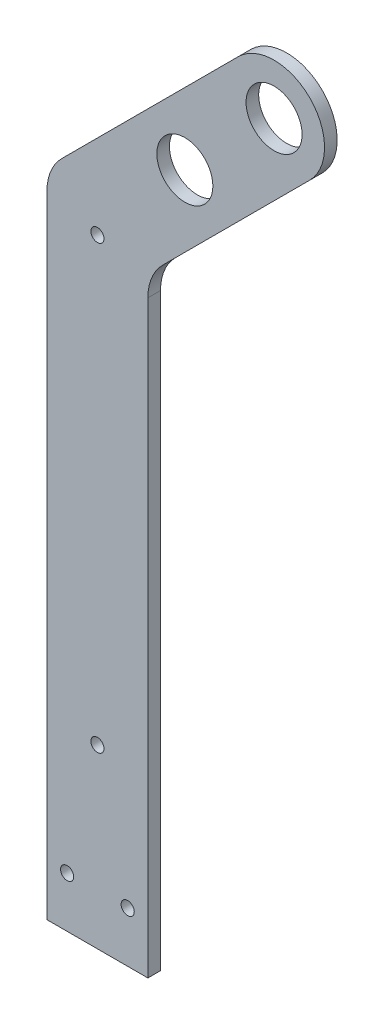
from build123d import *

# Parameters (mm, degrees)
SKETCH_1_R                = 20
SKETCH_1_R_2              = 11.1
EXTRUDE_1_DEPTH           = 60
EXTRUDE_2_DEPTH           = 30
SKETCH_4_R                = 11
EXTRUDE_3_DEPTH           = 5
SKETCH_8_R                = 11.1
CUT_EXTRUDE_1_DEPTH       = 100
FILLET_4_R                = 20
EXTRUDE_START             = -30
SKETCH_18_R               = 35
EXTRUDE_4_DEPTH           = 5
EXTRUDE_START_2           = -25
SKETCH_19_R               = 35
EXTRUDE_5_DEPTH           = 5
FILLET_5_R                = 10
CUT_EXTRUDE_9_DEPTH       = 388.169213652
CUT_EXTRUDE_9_DEPTH_BACK  = 388.169213652
SKETCH_21_R               = 2.6
CUT_EXTRUDE_10_DEPTH      = 407.881000043
CUT_EXTRUDE_10_DEPTH_BACK = 407.881000043
SKETCH_22_W               = 25
SKETCH_22_H               = 454.716430135
SKETCH_22_W_2             = 40
SKETCH_22_H_2             = 431.087956996


with BuildPart() as part:
    # 草图1 → 凸台-拉伸1 (new body)
    with BuildSketch(Plane.XY):
        Circle(SKETCH_1_R)
        Circle(SKETCH_1_R_2, mode=Mode.SUBTRACT)
    extrude(amount=EXTRUDE_1_DEPTH)

    # 草图2 → 凸台-拉伸2 (add, symmetric)
    with BuildSketch(Plane.XY.offset(30)):
        with BuildLine():
            Line((-14.142135624, 14.142135624), (-90, -61.715728753))
            Line((-90, -61.715728753), (-90, -320))
            Line((-90, -320), (-50, -320))
            Line((-50, -320), (-50, -78.284271247))
            Line((-50, -78.284271247), (14.142135624, -14.142135624))
            ThreePointArc((14.142135624, -14.142135624), (-14.142135624, -14.142135624), (-14.142135624, 14.142135624))
        make_face()
    extrude(amount=EXTRUDE_2_DEPTH, both=True)

    # 草图4 → 凸台-拉伸3 (add)
    with BuildSketch(Plane.XY.offset(60)):
        with BuildLine():
            Line((-90, -290), (-50, -290))
            Line((-50, -290), (-50, -350))
            ThreePointArc((-50, -350), (-70, -370), (-90, -350))
            Line((-90, -350), (-90, -290))
        make_face()
        with Locations((-70, -350)):
            Circle(SKETCH_4_R, mode=Mode.SUBTRACT)
    extrude_3 = extrude(amount=EXTRUDE_3_DEPTH)

    # 镜向1: 凸台-拉伸3 across plane
    add(extrude_3.mirror(Plane.XY.offset(30)))

    # 草图8 → 切除-拉伸1 (cut)
    with BuildSketch(Plane.XY.offset(60)):
        with Locations((-35.355339059, -35.355339059)):
            Circle(SKETCH_8_R)
    extrude(amount=-CUT_EXTRUDE_1_DEPTH, mode=Mode.SUBTRACT)

    # 圆角4
    fillet_4_edges = [part.edges().sort_by_distance(p)[0] for p in [
        (-50, -78.284271247, 30),
        (-90, -61.715728753, 30),
    ]]
    fillet(fillet_4_edges, radius=FILLET_4_R)

    # 草图18 → 凸台-拉伸4 (add)
    with BuildSketch(Plane.XY.offset(60).offset(EXTRUDE_START)):
        with BuildLine():
            ThreePointArc((15.487252676, -12.654841151), (14.833346688, -13.415357842), (14.142135624, -14.142135624))
            Line((14.142135624, -14.142135624), (-44.142135624, -72.426406871))
            ThreePointArc((-44.142135624, -72.426406871), (-48.47759065, -78.914873848), (-50, -86.568542495))
            Line((-50, -86.568542495), (-50, -128.513280962))
            Line((-50, -128.513280962), (20.291868618, -128.513280962))
            ThreePointArc((20.291868618, -128.513280962), (62.790327113, -100.116718851), (52.818780552, -49.986369028))
            Line((52.818780552, -49.986369028), (15.487252676, -12.654841151))
        make_face()
        with Locations((20.291868618, -82.513280962)):
            Circle(SKETCH_18_R, mode=Mode.SUBTRACT)
    extrude(amount=EXTRUDE_4_DEPTH)

    # 草图19 → 凸台-拉伸5 (add)
    with BuildSketch(Plane(origin=(0, 0, 0), x_dir=(-1, 0, 0), z_dir=(0, 0, -1)).offset(EXTRUDE_START_2)):
        with BuildLine():
            Line((50, -134.571348531), (50, -226.571348531))
            Line((50, -226.571348531), (-0.680255104, -226.571348531))
            ThreePointArc((-0.680255104, -226.571348531), (-46.680255104, -180.571348531), (-0.680255104, -134.571348531))
            Line((-0.680255104, -134.571348531), (50, -134.571348531))
        make_face()
        with Locations((-0.680255104, -180.571348531)):
            Circle(SKETCH_19_R, mode=Mode.SUBTRACT)
    extrude(amount=-EXTRUDE_5_DEPTH)

    # 圆角5
    # the kernel refuses this fillet: 10 mm, written as the material it adds along each edge
    with BuildSketch(Plane(origin=(-50, -226.571348531, 25), x_dir=(0, -1, 0), z_dir=(0, 0, 1)), Plane(origin=(-50, -128.513280962, 30), x_dir=(0, -1, 0), z_dir=(0, 0, 1))) as fillet_5_piece_1:
        with BuildLine():
            CenterArc((FILLET_5_R, FILLET_5_R), FILLET_5_R, 180, 90)
            Line((0, FILLET_5_R), (0, 0))
            Line((0, 0), (FILLET_5_R, 0))
        make_face()
    extrude(amount=5)

    # 草图21 → 切除-拉伸9 (cut, two sides: drawn at the far end of the back side and taken through both)
    with BuildSketch(Plane.XY.offset(65).offset(-CUT_EXTRUDE_9_DEPTH_BACK)):
        with Locations((-70, -75)):
            Circle(SKETCH_21_R)
        with Locations((-70, -250)):
            Circle(SKETCH_21_R)
        with Locations((-58, -300)):
            Circle(SKETCH_21_R)
        with Locations((-82, -300)):
            Circle(SKETCH_21_R)
    extrude(amount=CUT_EXTRUDE_9_DEPTH + CUT_EXTRUDE_9_DEPTH_BACK, mode=Mode.SUBTRACT)

    # 草图22 → 切除-拉伸10 (cut, two sides: drawn at the far end of the back side and taken through both)
    with BuildSketch(Plane.ZY.offset(90).offset(-CUT_EXTRUDE_10_DEPTH_BACK)):
        with Locations((7.5, -162.440295483)):
            Rectangle(SKETCH_22_W, SKETCH_22_H)
        with Locations((45, -154.456021502)):
            Rectangle(SKETCH_22_W_2, SKETCH_22_H_2)
    extrude(amount=CUT_EXTRUDE_10_DEPTH + CUT_EXTRUDE_10_DEPTH_BACK, mode=Mode.SUBTRACT)


solid = part.part
